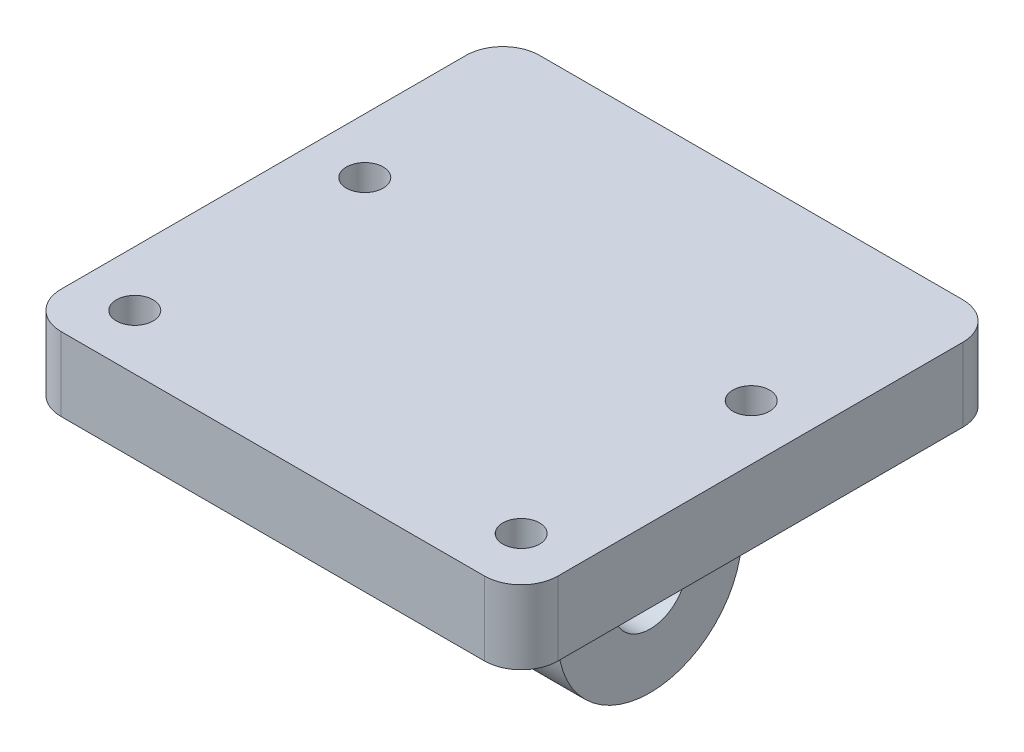
from build123d import *

# Parameters (mm, degrees)
SKETCH1_W               = 27
SKETCH1_H               = 26
SKETCH1_R               = 1
BOSS_EXTRUDE1_DEPTH     = 4
SKETCH2_W               = 5
SKETCH2_H               = 10
BOSS_EXTRUDE2_DEPTH     = 10
FILLET1_R               = 5
CUT_EXTRUDE1_DEPTH      = 11
CUT_EXTRUDE1_DEPTH_BACK = 22
SKETCH4_R               = 2
FILLET2_R               = 2


with BuildPart() as part:
    # Sketch1 → Boss-Extrude1 (new body)
    with BuildSketch(Plane(origin=(0, 0, 0), x_dir=(1, 0, 0), z_dir=(0, 1, 0))):
        Rectangle(SKETCH1_W, SKETCH1_H)
        with Locations(Location((-10.5, 2.5, 0), (0, 0, 270))):
            Circle(SKETCH1_R, mode=Mode.SUBTRACT)
        with Locations(Location((-10.5, -10, 0), (0, 0, 270))):
            Circle(SKETCH1_R, mode=Mode.SUBTRACT)
        with Locations(Location((10.5, -10, 0), (0, 0, 270))):
            Circle(SKETCH1_R, mode=Mode.SUBTRACT)
        with Locations(Location((10.5, 2.5, 0), (0, 0, 270))):
            Circle(SKETCH1_R, mode=Mode.SUBTRACT)
    extrude(amount=BOSS_EXTRUDE1_DEPTH)

    # Sketch2 → Boss-Extrude2 (add)
    with BuildSketch(Plane.XZ):
        with Locations((-5, 0)):
            Rectangle(SKETCH2_W, SKETCH2_H)
        with Locations((5, 0)):
            Rectangle(SKETCH2_W, SKETCH2_H)
    extrude(amount=BOSS_EXTRUDE2_DEPTH)

    # Fillet1
    fillet1_edges = [part.edges().sort_by_distance(p)[0] for p in [
        (5, -10, 5),
        (5, -10, -5),
        (-5, -10, 5),
        (-5, -10, -5),
    ]]
    fillet(fillet1_edges, radius=FILLET1_R - 0.0001)  # a hair under: the kernel refuses the full size

    # Sketch4 → Cut-Extrude1 (cut, two sides: drawn at the far end of the back side and taken through both)
    with BuildSketch(Plane.ZY.offset(7.5).offset(-CUT_EXTRUDE1_DEPTH_BACK)):
        with Locations(Location((0, -5, 0), (0, 0, 180))):
            Circle(SKETCH4_R)
    extrude(amount=CUT_EXTRUDE1_DEPTH + CUT_EXTRUDE1_DEPTH_BACK, mode=Mode.SUBTRACT)

    # Fillet2
    fillet2_edges = [part.edges().sort_by_distance(p)[0] for p in [
        (-13.5, 2, 13),
        (-13.5, 2, -13),
        (13.5, 2, -13),
        (13.5, 2, 13),
    ]]
    fillet(fillet2_edges, radius=FILLET2_R)


solid = part.part
